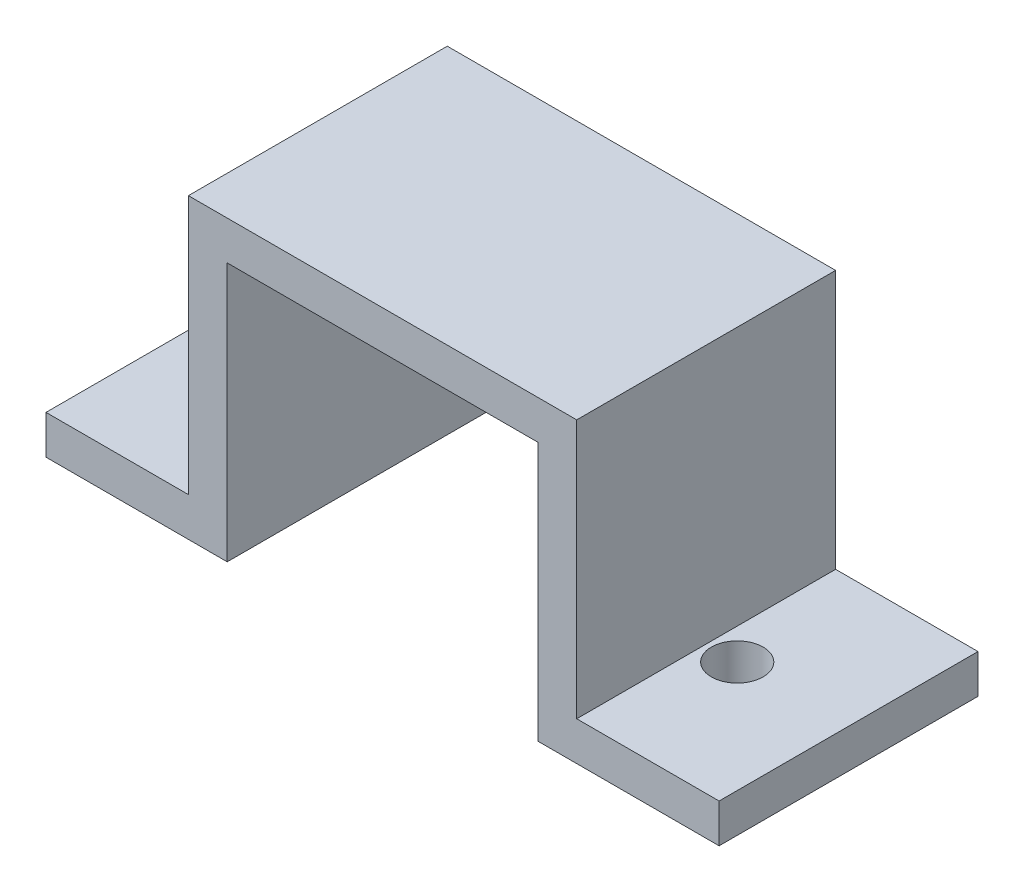
from build123d import *

# Parameters (mm, degrees)
EXTRUDE_1_DEPTH     = 10
SKETCH_2_R          = 1
CUT_EXTRUDE_1_DEPTH = 10


with BuildPart() as part:
    # 草圖1 → 伸長-薄件1 (new body)
    with BuildSketch(Plane.XY):
        Polygon((-13, -10), (-6, -10), (-6, 0), (6, 0), (6, -10), (13, -10), (13, -8.5), (7.5, -8.5), (7.5, 1.5), (-7.5, 1.5), (-7.5, -8.5), (-13, -8.5), align=None)
    extrude(amount=EXTRUDE_1_DEPTH)

    # 草圖2 → 除料-伸長1 (cut)
    with BuildSketch(Plane(origin=(0, -8.5, 0), x_dir=(1, 0, 0), z_dir=(0, 1, 0))):
        with Locations((8.7, -5)):
            Circle(SKETCH_2_R)
        with Locations((-8.7, -5)):
            Circle(SKETCH_2_R)
    extrude(amount=-CUT_EXTRUDE_1_DEPTH, mode=Mode.SUBTRACT)


solid = part.part
